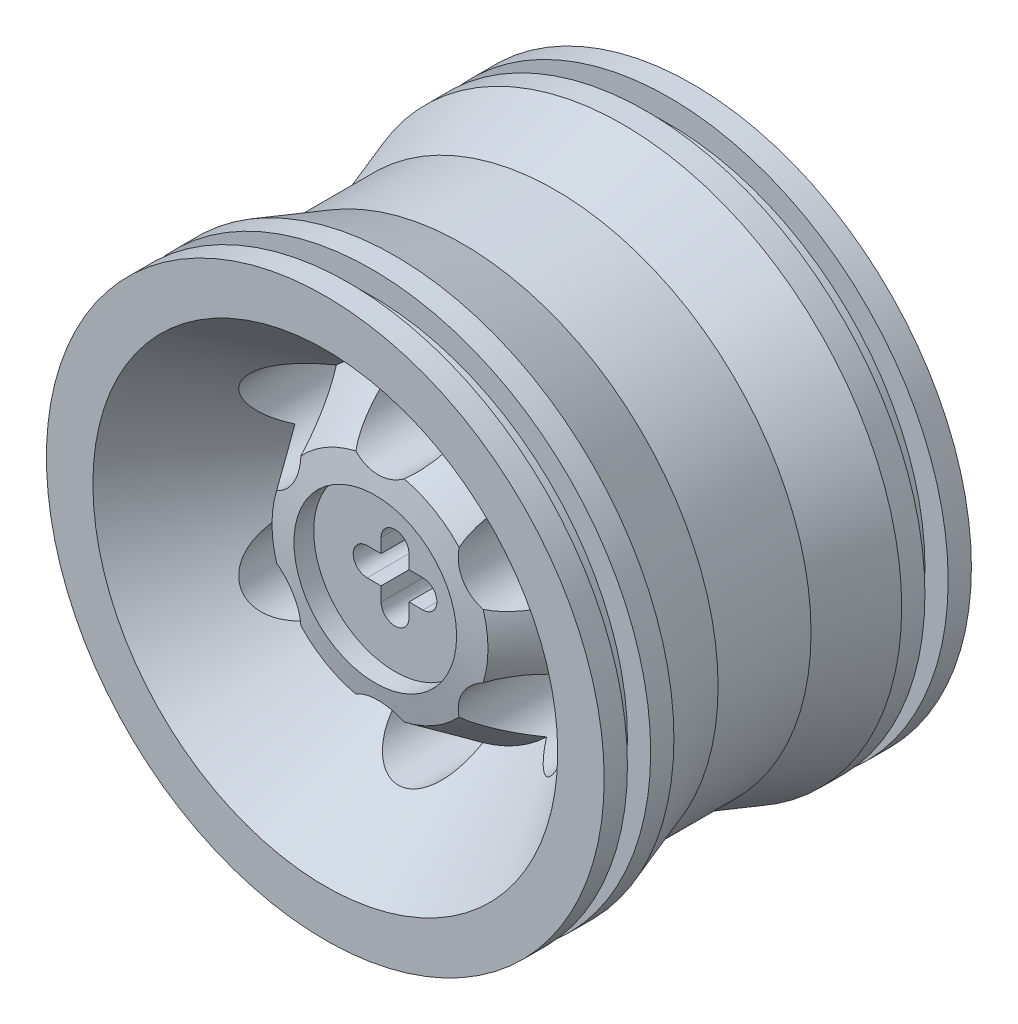
from build123d import *

# Parameters (mm, degrees)
EXTRUDE1_DEPTH      = 3.81
EXTRUDE2_DEPTH      = 0.508
CUT_EXTRUDE2_DEPTH  = 15.255714644
EXTRUDE3_DEPTH      = 3.302
EXTRUDE4_REACH      = 14.636
SKETCH9_W           = 3.553663376
SKETCH9_H           = 0.1905
SKETCH11_R          = 2.286
CUT_EXTRUDE3_DEPTH  = 13.636340451
SKETCH12_R          = 3.175
CUT_EXTRUDE4_DEPTH  = 0.508
SKETCH13_OUTSIDE_W  = 29.914
SKETCH13_OUTSIDE_H  = 14.674
SKETCH13_OUTSIDE_R  = 3.81
CUT_EXTRUDE5_DEPTH  = 15.255714644
CUT_EXTRUDE7_START  = 6.604
CUT_EXTRUDE7_DEPTH  = 6.604
SCALE1_SCALE_X      = 1
SCALE1_SCALE_Y      = 1
SCALE1_SCALE_Z      = 2.633333333
EXTRUDE6_DEPTH      = 30.24890252
EXTRUDE6_DEPTH_BACK = 30.24890252
SKETCH20_R          = 2.286
SKETCH21_R          = 12.7
SKETCH21_R_2        = 3.81
EXTRUDE7_DEPTH      = 10.16
EXTRUDE7_TAPER      = 35
SKETCH23_R          = 4.445
EXTRUDE8_DEPTH      = 3.81
EXTRUDE9_START      = -3.81
SKETCH24_R          = 4.445
EXTRUDE9_DEPTH      = 3.81
EXTRUDE10_START     = -3.81
EXTRUDE10_OUTLINE_R = 2.794
EXTRUDE10_DEPTH     = 3.81
EXTRUDE11_START     = -3.81
EXTRUDE11_OUTLINE_R = 2.794
EXTRUDE11_DEPTH     = 3.81
CHAMFER1_SIZE       = 2.54
CHAMFER1_SIZE_2     = 1.823758209


# Read off the part's stored shape, not the designer's step: Extrude10, Extrude11
with BuildPart() as part:
    # Sketch1 → Extrude1 (new body)
    with BuildSketch(Plane(origin=(0, 0, 0), x_dir=(1, 0, 0), z_dir=(0, 1, 0))):
        with BuildLine():
            Line((-7.62, 3.81), (0, 3.81))
            ThreePointArc((0, 3.81), (3.81, 0), (0, -3.81))
            Line((0, -3.81), (-7.62, -3.81))
            ThreePointArc((-7.62, -3.81), (-11.43, 0), (-7.62, 3.81))
        make_face()
    extrude(amount=EXTRUDE1_DEPTH)

    # Sketch4 → Extrude2 (add)
    with BuildSketch(Plane.XY.offset(3.81)):
        with BuildLine():
            Line((0, 0), (0, 3.81))
            Line((0, 3.81), (7.62, 3.81))
            ThreePointArc((7.62, 3.81), (10.314076836, 2.694076836), (11.43, 0))
            Line((11.43, 0), (7.62, 0))
            Line((7.62, 0), (0, 0))
        make_face()
    extrude2 = extrude(amount=-EXTRUDE2_DEPTH)

    # Sketch6 → Cut-Extrude2 (cut, through all)
    with BuildSketch(Plane.XY.offset(3.81)):
        with BuildLine():
            Line((6.858, 2.032), (6.858, 1.016))
            ThreePointArc((6.858, 1.016), (6.783605122, 0.836394878), (6.604, 0.762))
            Line((6.604, 0.762), (5.588, 0.762))
            ThreePointArc((5.588, 0.762), (5.408394878, 0.687605122), (5.334, 0.508))
            Line((5.334, 0.508), (5.334, -0.508))
            ThreePointArc((5.334, -0.508), (5.408394878, -0.687605122), (5.588, -0.762))
            Line((5.588, -0.762), (6.604, -0.762))
            ThreePointArc((6.604, -0.762), (6.783605122, -0.836394878), (6.858, -1.016))
            Line((6.858, -1.016), (6.858, -2.032))
            ThreePointArc((6.858, -2.032), (6.932394878, -2.211605122), (7.112, -2.286))
            Line((7.112, -2.286), (8.128, -2.286))
            ThreePointArc((8.128, -2.286), (8.307605122, -2.211605122), (8.382, -2.032))
            Line((8.382, -2.032), (8.382, -1.016))
            ThreePointArc((8.382, -1.016), (8.456394878, -0.836394878), (8.636, -0.762))
            Line((8.636, -0.762), (9.652, -0.762))
            ThreePointArc((9.652, -0.762), (9.831605122, -0.687605122), (9.906, -0.508))
            Line((9.906, -0.508), (9.906, 0.508))
            ThreePointArc((9.906, 0.508), (9.831605122, 0.687605122), (9.652, 0.762))
            Line((9.652, 0.762), (8.636, 0.762))
            ThreePointArc((8.636, 0.762), (8.456394878, 0.836394878), (8.382, 1.016))
            Line((8.382, 1.016), (8.382, 2.032))
            ThreePointArc((8.382, 2.032), (8.307605122, 2.211605122), (8.128, 2.286))
            Line((8.128, 2.286), (7.112, 2.286))
            ThreePointArc((7.112, 2.286), (6.932394878, 2.211605122), (6.858, 2.032))
        make_face()
    cut_extrude2 = extrude(amount=-CUT_EXTRUDE2_DEPTH, mode=Mode.SUBTRACT)

    # Sketch8 → Extrude3 (add)
    with BuildSketch(Plane(origin=(0, 0, 3.302), x_dir=(-1, 0, 0), z_dir=(0, 0, -1))):
        with BuildLine():
            Line((-10.795, 0), (-10.414, 0))
            ThreePointArc((-10.414, 0), (-9.726056742, 1.836017701), (-8.001, 2.767900829))
            Line((-8.001, 2.767900829), (-8.001, 3.152057106))
            ThreePointArc((-8.001, 3.152057106), (-9.995952441, 2.106056742), (-10.795, 0))
        make_face()
        with BuildLine():
            Line((-4.826, 0), (-4.445, 0))
            ThreePointArc((-4.445, 0), (-5.244047559, 2.106056742), (-7.239, 3.152057106))
            Line((-7.239, 3.152057106), (-7.239, 2.767900829))
            ThreePointArc((-7.239, 2.767900829), (-5.513943258, 1.836017701), (-4.826, 0))
        make_face()
    extrude3 = extrude(amount=EXTRUDE3_DEPTH)

    # Sketch9 → Extrude4 (add, up to next)
    with BuildSketch(Plane(origin=(0, 0, 0), x_dir=(-1, 0, 0), z_dir=(0, 0, -1)), mode=Mode.PRIVATE) as extrude4_sk1:
        with Locations((-2.858668312, 0.09525)):
            Rectangle(SKETCH9_W, SKETCH9_H)
    extrude4_tool1 = extrude(extrude4_sk1.sketch, amount=-EXTRUDE4_REACH, mode=Mode.PRIVATE) - part.part
    extrude4 = extrude4_tool1.solids().sort_by_distance((2.858668, 0.09525, 0))[0]
    add(extrude4)

    # Mirror5: Extrude2, Cut-Extrude2, Extrude3, Extrude4 across plane
    add(extrude2.mirror(Plane(origin=(7.62, 0, 0), x_dir=(1, 0, 0), z_dir=(0, 0, -1))))
    add(cut_extrude2.mirror(Plane(origin=(7.62, 0, 0), x_dir=(1, 0, 0), z_dir=(0, 0, -1))), mode=Mode.SUBTRACT)
    add(extrude3.mirror(Plane(origin=(7.62, 0, 0), x_dir=(1, 0, 0), z_dir=(0, 0, -1))))
    add(extrude4.mirror(Plane(origin=(7.62, 0, 0), x_dir=(1, 0, 0), z_dir=(0, 0, -1))))

    # Sketch11 → Cut-Extrude3 (cut, through all)
    with BuildSketch(Plane(origin=(0, 3.81, 0), x_dir=(1, 0, 0), z_dir=(0, 1, 0))):
        with Locations(Location((0, 0, 0), (0, 0, 270))):
            Circle(SKETCH11_R)
        with Locations(Location((-7.62, 0, 0), (0, 0, 270))):
            Circle(SKETCH11_R)
    extrude(amount=-CUT_EXTRUDE3_DEPTH, mode=Mode.SUBTRACT)

    # Sketch12 → Cut-Extrude4 (cut)
    with BuildSketch(Plane(origin=(0, 3.81, 0), x_dir=(1, 0, 0), z_dir=(0, 1, 0))):
        with Locations(Location((0, 0, 0), (0, 0, 270))):
            Circle(SKETCH12_R)
        with Locations(Location((-7.62, 0, 0), (0, 0, 270))):
            Circle(SKETCH12_R)
    extrude(amount=-CUT_EXTRUDE4_DEPTH, mode=Mode.SUBTRACT)

    # Mirror6: part across face


with BuildPart() as part_1:
    add(part.part)
    add(part.part.mirror(Plane(origin=(-2.524422527, 0, 0), x_dir=(0, 0, 1), z_dir=(0, -1, 0))))

    # Sketch13 outside → Cut-Extrude5 (cut, through all)
    with BuildSketch(Plane.XY.offset(3.81)):
        Rectangle(SKETCH13_OUTSIDE_W, SKETCH13_OUTSIDE_H)
        with Locations((7.62, 0)):
            Circle(SKETCH13_OUTSIDE_R, mode=Mode.SUBTRACT)
    extrude(amount=-CUT_EXTRUDE5_DEPTH, mode=Mode.SUBTRACT)

    # Sketch15 → Cut-Extrude7 (cut)
    with BuildSketch(Plane.XY.offset(-3.302).offset(CUT_EXTRUDE7_START)):
        with BuildLine():
            Line((4.486048338, 2.166667252), (5.299185915, 2.166667252))
            ThreePointArc((5.299185915, 2.166667252), (4.44500552, -0.00592023), (5.307282146, -2.175307134))
            Line((5.307282146, -2.175307134), (4.492039183, -2.175307134))
            ThreePointArc((4.492039183, -2.175307134), (3.810003627, -0.005256847), (4.486048338, 2.166667252))
        make_face()
    extrude(amount=-CUT_EXTRUDE7_DEPTH, mode=Mode.SUBTRACT)


with BuildPart() as part_2:
    # Scale1: scaled about (0, 0, 0)
    add(part_1.part.scale((SCALE1_SCALE_X, SCALE1_SCALE_Y, SCALE1_SCALE_Z), about=(0, 0, 0)))

    # Sketch17 → Revolve1 (revolve)
    with BuildSketch(Plane(origin=(0, 0, 0), x_dir=(1, 0, 0), z_dir=(0, 1, 0))):
        Polygon((10.414, 10.033), (10.414, -10.033), (22.86, -10.033), (22.86, -8.763), (21.59, -8.763), (21.59, -7.493), (22.86, -7.493), (22.86, -6.223), (21.59, -2.54), (21.59, 2.54), (22.86, 6.223), (22.86, 7.493), (21.59, 7.493), (21.59, 8.763), (22.86, 8.763), (22.86, 10.033), align=None)
    revolve(axis=Axis((7.62, 0, 0), (0, 0, -1)))

    # Sketch20 → Extrude6 (cut, two sides: drawn at the far end of the back side and taken through both)
    with BuildSketch(Plane.XY.offset(-EXTRUDE6_DEPTH_BACK)):
        with Locations((7.62, 7.62)):
            Circle(SKETCH20_R)
        with Locations((14.219113577, 3.81)):
            Circle(SKETCH20_R)
        with Locations((14.219113577, -3.81)):
            Circle(SKETCH20_R)
        with Locations((7.62, -7.62)):
            Circle(SKETCH20_R)
        with Locations((1.020886423, -3.81)):
            Circle(SKETCH20_R)
        with Locations((1.020886423, 3.81)):
            Circle(SKETCH20_R)
    extrude(amount=EXTRUDE6_DEPTH + EXTRUDE6_DEPTH_BACK, mode=Mode.SUBTRACT)

    # Sketch21 → Extrude7 (cut)
    with BuildSketch(Plane.XY.offset(10.033)):
        with Locations((7.62, 0)):
            Circle(SKETCH21_R)
        with Locations((7.62, 0)):
            Circle(SKETCH21_R_2, mode=Mode.SUBTRACT)
    extrude7 = extrude(amount=-EXTRUDE7_DEPTH, taper=EXTRUDE7_TAPER, mode=Mode.SUBTRACT)

    # Mirror7: Extrude7 across plane
    add(extrude7.mirror(Plane.XY), mode=Mode.SUBTRACT)

    # Sketch23 → Extrude8 (cut)
    with BuildSketch(Plane.XY.offset(10.033)):
        with Locations((7.62, 0)):
            Circle(SKETCH23_R)
    extrude(amount=-EXTRUDE8_DEPTH, mode=Mode.SUBTRACT)

    # Sketch24 → Extrude9 (cut)
    with BuildSketch(Plane(origin=(0, 0, -10.033), x_dir=(-1, 0, 0), z_dir=(0, 0, -1)).offset(EXTRUDE9_START)):
        with Locations(Location((-7.62, 0, 0), (0, 0, 180))):
            Circle(SKETCH24_R)
    extrude(amount=EXTRUDE9_DEPTH, mode=Mode.SUBTRACT)

    # Extrude10 outline → Extrude10 (add)
    with BuildSketch(Plane.XY.offset(6.223).offset(EXTRUDE10_START)):
        with Locations((7.62, 0)):
            Circle(EXTRUDE10_OUTLINE_R)
        with BuildLine():
            ThreePointArc((8.382, -1.524), (7.62, -2.286), (6.858, -1.524))
            Line((6.858, -1.524), (6.858, -0.762))
            Line((6.858, -0.762), (6.096, -0.762))
            ThreePointArc((6.096, -0.762), (5.334, 0), (6.096, 0.762))
            Line((6.096, 0.762), (6.858, 0.762))
            Line((6.858, 0.762), (6.858, 1.524))
            ThreePointArc((6.858, 1.524), (7.62, 2.286), (8.382, 1.524))
            Line((8.382, 1.524), (8.382, 0.762))
            Line((8.382, 0.762), (9.144, 0.762))
            ThreePointArc((9.144, 0.762), (9.906, 0), (9.144, -0.762))
            Line((9.144, -0.762), (8.382, -0.762))
            Line((8.382, -0.762), (8.382, -1.524))
        make_face(mode=Mode.SUBTRACT)
    extrude(amount=EXTRUDE10_DEPTH)

    # Extrude11 outline → Extrude11 (add)
    with BuildSketch(Plane(origin=(0, 0, -6.223), x_dir=(-1, 0, 0), z_dir=(0, 0, -1)).offset(EXTRUDE11_START)):
        with Locations((-7.62, 0)):
            Circle(EXTRUDE11_OUTLINE_R)
        with BuildLine():
            ThreePointArc((-6.858, -1.524), (-7.62, -2.286), (-8.382, -1.524))
            Line((-8.382, -1.524), (-8.382, -0.762))
            Line((-8.382, -0.762), (-9.144, -0.762))
            ThreePointArc((-9.144, -0.762), (-9.906, 0), (-9.144, 0.762))
            Line((-9.144, 0.762), (-8.382, 0.762))
            Line((-8.382, 0.762), (-8.382, 1.524))
            ThreePointArc((-8.382, 1.524), (-7.62, 2.286), (-6.858, 1.524))
            Line((-6.858, 1.524), (-6.858, 0.762))
            Line((-6.858, 0.762), (-6.096, 0.762))
            ThreePointArc((-6.096, 0.762), (-5.334, 0), (-6.096, -0.762))
            Line((-6.096, -0.762), (-6.858, -0.762))
            Line((-6.858, -0.762), (-6.858, -1.524))
        make_face(mode=Mode.SUBTRACT)
    extrude(amount=EXTRUDE11_DEPTH)

    # Chamfer1
    # the kernel refuses this chamfer: 2.54, 1.823758209 mm, written as the material it takes off along each edge
    with BuildSketch(Plane(origin=(7.62, 0, 9.126126016), x_dir=(1, 0, 0), z_dir=(0, -1, 0))) as chamfer1_piece_1:
        Polygon((4.445 + CHAMFER1_SIZE * 0.573576436351, -CHAMFER1_SIZE * 0.819152044289), (4.445, -CHAMFER1_SIZE_2), (4.445, 0), align=None)
    revolve(axis=Axis((7.62, 0, 9.126126016), (0, 0, 1)), mode=Mode.SUBTRACT)
    with BuildSketch(Plane(origin=(7.62, 0, -9.126126016), x_dir=(1, 0, 0), z_dir=(0, -1, 0))) as chamfer1_piece_2:
        Polygon((4.445, CHAMFER1_SIZE), (4.445 + CHAMFER1_SIZE_2 * 0.57357643647, CHAMFER1_SIZE_2 * 0.819152044458), (4.445, 0), align=None)
    revolve(axis=Axis((7.62, 0, -9.126126016), (0, 0, 1)), mode=Mode.SUBTRACT)


solid = part_2.part
